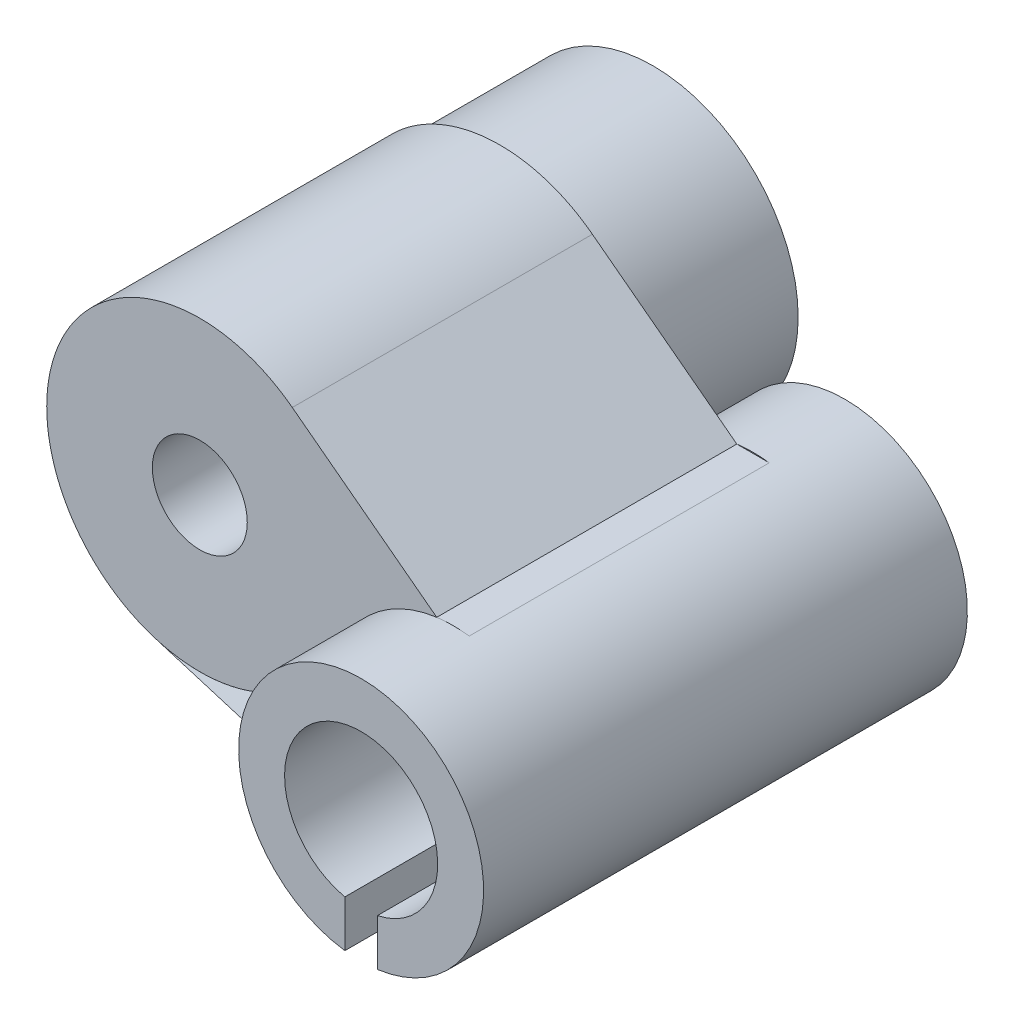
from build123d import *
from build123d.topology import SkipClean

# Parameters (mm, degrees)
ESQUISSE1_R         = 5
ESQUISSE1_R_2       = 1.55
BOSS_EXTRU_1_DEPTH  = 9.8
BOSS_EXTRUDE3_START = -9.8
BOSS_EXTRUDE3_DEPTH = 9.8
BOSS_EXTRUDE4_START = 3
BOSS_EXTRUDE4_DEPTH = 3
BOSS_EXTRUDE5_START = 5
SKETCH6_R           = 4.741358269
SKETCH6_R_2         = 1.55
BOSS_EXTRUDE5_DEPTH = 5
SKETCH7_R           = 0.5
BOSS_EXTRUDE6_DEPTH = 2


# Read off the part's stored shape, not the designer's step: Boss-Extrude3
with BuildPart() as part:
    # Esquisse1 → Boss.-Extru.1 (new body)
    with BuildSketch(Plane.XY):
        Circle(ESQUISSE1_R)
        Circle(ESQUISSE1_R_2, mode=Mode.SUBTRACT)
    extrude(amount=BOSS_EXTRU_1_DEPTH)

    # Boss-Extrude3 outline → Boss-Extrude3 (add)
    with BuildSketch(Plane(origin=(0, 0, 0), x_dir=(-1, 0, 0), z_dir=(0, 0, -1)).offset(BOSS_EXTRUDE3_START)):
        with BuildLine():
            Line((-7.73730203, -5.998733154), (-7.73730203, -7.520335784))
            ThreePointArc((-7.73730203, -7.520335784), (-7.418680778, -7.464502766), (-7.105612856, -7.383106794))
            Line((-7.105612856, -7.383106794), (1.353806639, -4.814343909))
            ThreePointArc((1.353806639, -4.814343909), (-1.32534738, -4.821672129), (-3.623777148, -3.445031085))
            ThreePointArc((-3.623777148, -3.445031085), (-4.983596761, 0.404676815), (-3.020481574, 3.98455657))
            Line((-3.020481574, 3.98455657), (-7.73730203, 0.408984477))
            Line((-7.73730203, 0.408984477), (-8.798377048, 0.408984477))
            ThreePointArc((-8.798377048, 0.408984477), (-12.267839539, -3.555675653), (-8.798377048, -7.520335784))
            Line((-8.798377048, -7.520335784), (-8.798377048, -5.998733154))
            ThreePointArc((-8.798377048, -5.998733154), (-8.267839539, -1.055675653), (-7.73730203, -5.998733154))
        make_face()
    extrude(amount=BOSS_EXTRUDE3_DEPTH)

    # Sketch5 → Boss-Extrude4 (add)
    with BuildSketch(Plane.XY.offset(9.8).offset(BOSS_EXTRUDE4_START)):
        with BuildLine():
            Line((7.73730203, -5.998733154), (7.73730203, -7.520335784))
            ThreePointArc((7.73730203, -7.520335784), (8.267839539, 0.444324347), (8.798377048, -7.520335784))
            Line((8.798377048, -7.520335784), (8.798377048, -5.998733154))
            ThreePointArc((8.798377048, -5.998733154), (8.267839539, -1.055675653), (7.73730203, -5.998733154))
        make_face()
    boss_extrude4 = extrude(amount=-BOSS_EXTRUDE4_DEPTH)

    # Mirror1: Boss-Extrude4 across plane
    add(boss_extrude4.mirror(Plane.XY.offset(4.9)))

    # Sketch6 → Boss-Extrude5 (add)
    with SkipClean():  # the faces are left unmerged after this step: merging them gives an invalid solid
        with BuildSketch(Plane(origin=(0, 0, 0), x_dir=(-1, 0, 0), z_dir=(0, 0, -1)).offset(BOSS_EXTRUDE5_START)):
            with Locations(Location((0, 0, 0), (0, 0, 180))):
                Circle(SKETCH6_R)
            Circle(SKETCH6_R_2, mode=Mode.SUBTRACT)
        extrude(amount=-BOSS_EXTRUDE5_DEPTH)

    # Sketch7 → Boss-Extrude6 (add)
    with SkipClean():  # the faces are left unmerged after this step: merging them gives an invalid solid
        with BuildSketch(Plane(origin=(0, 0, -5), x_dir=(-1, 0, 0), z_dir=(0, 0, -1))):
            with Locations((0.408594664, -2.652025432)):
                Circle(SKETCH7_R)
        extrude(amount=BOSS_EXTRUDE6_DEPTH)


solid = part.part
